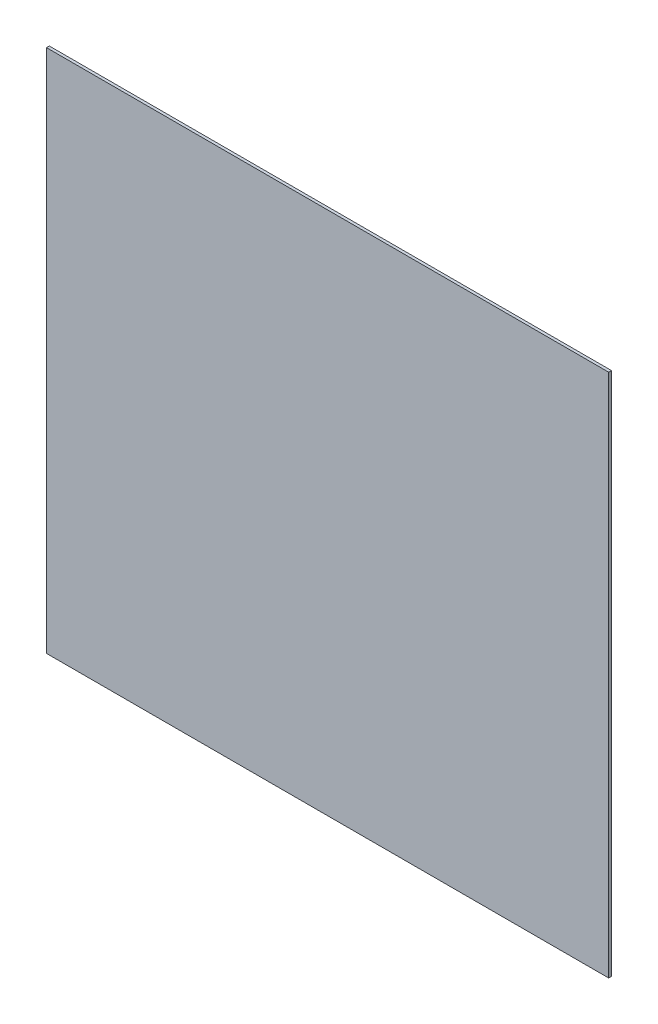
from build123d import *

# Parameters (mm, degrees)
SKETCH2_W           = 300
SKETCH2_H           = 280
BOSS_EXTRUDE2_DEPTH = 1.5


with BuildPart() as part:
    # Sketch2 → Boss-Extrude2 (new body)
    with BuildSketch(Plane.XY):
        Rectangle(SKETCH2_W, SKETCH2_H)
    extrude(amount=BOSS_EXTRUDE2_DEPTH)


solid = part.part
